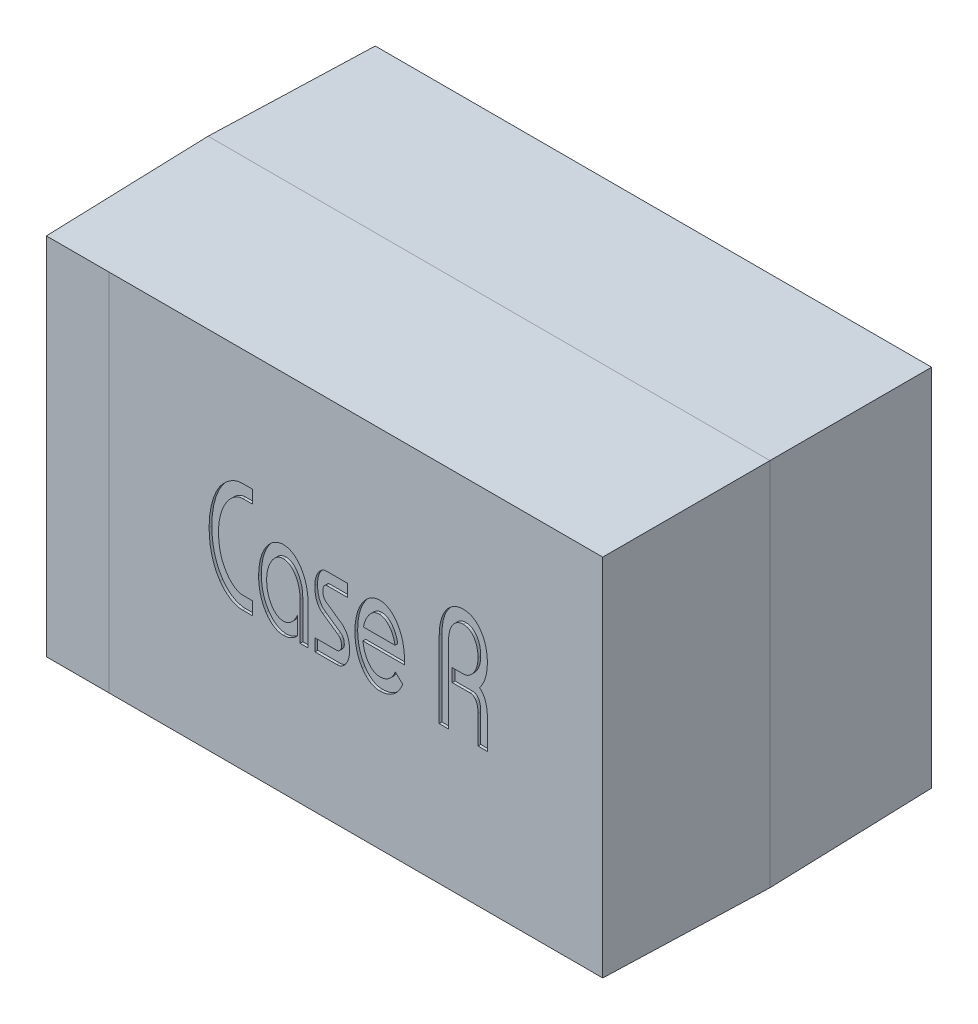
from build123d import *
from OCP.BRepFilletAPI import BRepFilletAPI_MakeChamfer

# Parameters (mm, degrees)
SKETCH1_W           = 2.05
SKETCH1_H           = 1.35
BOSS_EXTRUDE1_DEPTH = 1.2
CHAMFER3_SIZE       = 0.6
CHAMFER3_SIZE2      = 0.01
CHAMFER4_SIZE       = 0.01
CHAMFER4_SIZE_2     = 0.6
SKETCH3_W           = 0.228351356
SKETCH3_H           = 1.33
CUT_EXTRUDE1_DEPTH  = 0.01
SKETCH4_W           = 0.228351356
SKETCH4_H           = 1.33
BOSS_EXTRUDE4_DEPTH = 0.01
CUT_EXTRUDE2_DEPTH  = 0.01


with BuildPart() as part:
    # Sketch1 → Boss-Extrude1 (new body)
    with BuildSketch(Plane.XY):
        with Locations((1.025, 0.675)):
            Rectangle(SKETCH1_W, SKETCH1_H)
    extrude(amount=BOSS_EXTRUDE1_DEPTH)

    # Chamfer3: one chamfer whose edges measure the first distance from different faces: ONE call of the kernel's chamfer builder (chamfer() names one face for all edges)
    chamfer3_edges_1 = [part.edges().sort_by_distance(p)[0] for p in [
        (2.05, 0.675, 1.2),
    ]]
    chamfer3_side_1 = [part.faces().sort_by_distance(p)[0] for p in [
        (2.05, 0.675, 0.6),
    ]]
    chamfer3_edges_2 = [part.edges().sort_by_distance(p)[0] for p in [
        (1.025, 1.35, 1.2),
    ]]
    chamfer3_side_2 = [part.faces().sort_by_distance(p)[0] for p in [
        (1.025, 1.35, 0.6),
    ]]
    chamfer3_edges_3 = [part.edges().sort_by_distance(p)[0] for p in [
        (0, 0.675, 1.2),
    ]]
    chamfer3_side_3 = [part.faces().sort_by_distance(p)[0] for p in [
        (0, 0.675, 0.6),
    ]]
    chamfer3_edges_4 = [part.edges().sort_by_distance(p)[0] for p in [
        (1.025, 0, 1.2),
    ]]
    chamfer3_side_4 = [part.faces().sort_by_distance(p)[0] for p in [
        (1.025, 0, 0.6),
    ]]
    chamfer3 = BRepFilletAPI_MakeChamfer(part.part.solid().wrapped)
    for e in chamfer3_edges_1:
        chamfer3.Add(CHAMFER3_SIZE, CHAMFER3_SIZE2, e.wrapped, chamfer3_side_1[0].wrapped)  # the first distance lies on this face
    for e in chamfer3_edges_2:
        chamfer3.Add(CHAMFER3_SIZE, CHAMFER3_SIZE2, e.wrapped, chamfer3_side_2[0].wrapped)  # the first distance lies on this face
    for e in chamfer3_edges_3:
        chamfer3.Add(CHAMFER3_SIZE, CHAMFER3_SIZE2, e.wrapped, chamfer3_side_3[0].wrapped)  # the first distance lies on this face
    for e in chamfer3_edges_4:
        chamfer3.Add(CHAMFER3_SIZE, CHAMFER3_SIZE2, e.wrapped, chamfer3_side_4[0].wrapped)  # the first distance lies on this face
    add(Compound.cast(chamfer3.Shape()), mode=Mode.REPLACE)

    # Chamfer4
    chamfer4_edges_1 = [part.edges().sort_by_distance(p)[0] for p in [
        (1.025, 1.35, 0),
    ]]
    chamfer4_side_1 = [part.faces().sort_by_distance(p)[0] for p in [
        (1.025, 1.3498, 0),
    ]]
    chamfer4_edges_2 = [part.edges().sort_by_distance(p)[0] for p in [
        (0, 0.675, 0),
    ]]
    chamfer4_side_2 = [part.faces().sort_by_distance(p)[0] for p in [
        (0, 0.675, 0.0002),
    ]]
    chamfer4_edges_3 = [part.edges().sort_by_distance(p)[0] for p in [
        (1.025, 0, 0),
    ]]
    chamfer4_side_3 = [part.faces().sort_by_distance(p)[0] for p in [
        (1.025, 0, 0.0002),
    ]]
    chamfer4_edges_4 = [part.edges().sort_by_distance(p)[0] for p in [
        (2.05, 0.675, 0),
    ]]
    chamfer4_side_4 = [part.faces().sort_by_distance(p)[0] for p in [
        (2.0498, 0.675, 0),
    ]]
    chamfer4 = BRepFilletAPI_MakeChamfer(part.part.solid().wrapped)
    for e in chamfer4_edges_1:
        chamfer4.Add(CHAMFER4_SIZE - 0.0001, CHAMFER4_SIZE_2 - 0.0001, e.wrapped, chamfer4_side_1[0].wrapped)
    for e in chamfer4_edges_2:
        chamfer4.Add(CHAMFER4_SIZE_2 - 0.0001, CHAMFER4_SIZE - 0.0001, e.wrapped, chamfer4_side_2[0].wrapped)
    for e in chamfer4_edges_3:
        chamfer4.Add(CHAMFER4_SIZE_2 - 0.0001, CHAMFER4_SIZE - 0.0001, e.wrapped, chamfer4_side_3[0].wrapped)
    for e in chamfer4_edges_4:
        chamfer4.Add(CHAMFER4_SIZE - 0.0001, CHAMFER4_SIZE_2 - 0.0001, e.wrapped, chamfer4_side_4[0].wrapped)
    add(Compound.cast(chamfer4.Shape()), mode=Mode.REPLACE)  # a hair under: the kernel refuses the full size

    # Sketch3 → Cut-Extrude1 (cut)
    with BuildSketch(Plane.XY.offset(1.2)):
        with Locations((0.124175678, 0.675)):
            Rectangle(SKETCH3_W, SKETCH3_H)
    extrude(amount=-CUT_EXTRUDE1_DEPTH, mode=Mode.SUBTRACT)

    # Sketch5 → Cut-Extrude2 (cut)
    # profile 1 of 5: a face of its own
    with BuildSketch(Plane.XY.offset(1.2)):
        with BuildLine():
            Line((0.76121747, 0.515614059), (0.726594019, 0.515614059))
            add(Edge.make_bspline(
                [(0.726594019, 0.515614059), (0.722765896, 0.515771693), (0.71510314, 0.51608723), (0.703751237, 0.518790618), (0.692510981, 0.522892757), (0.681565006, 0.528842175), (0.670982858, 0.536243435), (0.66092916, 0.54506545), (0.651604582, 0.555367055), (0.646019402, 0.562972258), (0.643162179, 0.566862867)],
                knots=[0, 0, 0, 0, 0.901384534, 1.804301883, 2.737231396, 3.715875979, 4.731708272, 5.776406767, 6.862471662, 8, 8, 8, 8], degree=3))
            add(Edge.make_bspline(
                [(0.643162179, 0.566862867), (0.640068542, 0.571612157), (0.633758452, 0.581299279), (0.625910995, 0.597150464), (0.619190631, 0.614287288), (0.613572335, 0.632641349), (0.60916741, 0.652143405), (0.606105902, 0.672613602), (0.60412011, 0.693954205), (0.603914963, 0.708478889), (0.603810415, 0.71588098)],
                knots=[0, 0, 0, 0, 0.869024074, 1.772547916, 2.70757886, 3.690855553, 4.714628528, 5.77206063, 6.864594243, 8, 8, 8, 8], degree=3))
            add(Edge.make_bspline(
                [(0.603810415, 0.71588098), (0.603917977, 0.723231881), (0.604129384, 0.737679707), (0.606079771, 0.758927533), (0.609262739, 0.779308251), (0.61367456, 0.798781102), (0.619237217, 0.81719116), (0.626102411, 0.834341001), (0.633825574, 0.850364382), (0.640184432, 0.860104385), (0.643314705, 0.864899092)],
                knots=[0, 0, 0, 0, 1.127540334, 2.216123785, 3.270236229, 4.290144326, 5.277090742, 6.217127349, 7.122345999, 8, 8, 8, 8], degree=3))
            add(Edge.make_bspline(
                [(0.643314705, 0.864899092), (0.646152782, 0.8687824), (0.651699346, 0.876371699), (0.661291058, 0.886347154), (0.671278036, 0.895147868), (0.681869745, 0.902479445), (0.692835994, 0.908275415), (0.703947069, 0.912565587), (0.715243726, 0.915103733), (0.722819553, 0.915444354), (0.726594019, 0.915614059)],
                knots=[0, 0, 0, 0, 1.138826309, 2.225652577, 3.27197478, 4.289805443, 5.270858778, 6.205250352, 7.105810983, 8, 8, 8, 8], degree=3))
            Line((0.726594019, 0.915614059), (0.76121747, 0.915614059))
            Line((0.76121747, 0.915614059), (0.76121747, 0.868254669))
            Line((0.76121747, 0.868254669), (0.727127861, 0.868254669))
            add(Edge.make_bspline(
                [(0.727127861, 0.868254669), (0.724599618, 0.868110778), (0.719443526, 0.867817326), (0.711675587, 0.865720664), (0.703893131, 0.86220663), (0.696059757, 0.857469032), (0.688417717, 0.851548351), (0.681159359, 0.844505871), (0.674143918, 0.836575394), (0.67000027, 0.830650441), (0.667871426, 0.827606433)],
                knots=[0, 0, 0, 0, 0.813313755, 1.658670407, 2.570794204, 3.554385538, 4.598455433, 5.674757172, 6.805381345, 8, 8, 8, 8], degree=3))
            add(Edge.make_bspline(
                [(0.667871426, 0.827606433), (0.665456311, 0.823785469), (0.660603465, 0.81610776), (0.654661437, 0.803703915), (0.649404707, 0.790744584), (0.645270409, 0.777046128), (0.641928252, 0.762713042), (0.639745802, 0.747683009), (0.638195555, 0.732004748), (0.638050322, 0.721325124), (0.637976288, 0.71588098)],
                knots=[0, 0, 0, 0, 0.923892765, 1.856437245, 2.808522738, 3.782258558, 4.780023244, 5.816220665, 6.886776318, 8, 8, 8, 8], degree=3))
            add(Edge.make_bspline(
                [(0.637976288, 0.71588098), (0.638050492, 0.710436873), (0.638196057, 0.699757323), (0.639743905, 0.684078534), (0.641938588, 0.669025872), (0.645258556, 0.654662402), (0.649403646, 0.640940317), (0.654678522, 0.627964547), (0.66060101, 0.615502592), (0.665455648, 0.607773105), (0.667871426, 0.603926738)],
                knots=[0, 0, 0, 0, 1.111252342, 2.179912213, 3.214274696, 4.215331887, 5.187343378, 6.137742881, 7.073298734, 8, 8, 8, 8], degree=3))
            add(Edge.make_bspline(
                [(0.667871426, 0.603926738), (0.669996099, 0.600829041), (0.674120402, 0.594815955), (0.681164531, 0.586807376), (0.688391665, 0.57967618), (0.696066487, 0.573772118), (0.703870145, 0.56899161), (0.71170818, 0.56562753), (0.719428854, 0.563383735), (0.724596937, 0.563108324), (0.727127861, 0.562973449)],
                knots=[0, 0, 0, 0, 1.204278239, 2.337681846, 3.416432142, 4.457388018, 5.438045713, 6.344187209, 7.189112018, 8, 8, 8, 8], degree=3))
            Line((0.727127861, 0.562973449), (0.76121747, 0.562973449))
            Line((0.76121747, 0.562973449), (0.76121747, 0.515614059))
        make_face()
    # profile 2 of 5: a face of its own
    with BuildSketch(Plane.XY.offset(1.2)):
        with BuildLine():
            add(Edge.make_bspline(
                [(0.874696974, 0.752258482), (0.87262919, 0.752174568), (0.868523457, 0.752007951), (0.86252443, 0.750542125), (0.856702867, 0.748354232), (0.851212309, 0.745061627), (0.84586543, 0.74096709), (0.840799341, 0.735920864), (0.835965791, 0.729978641), (0.831465348, 0.723241226), (0.827306697, 0.715902216), (0.823622052, 0.70811585), (0.820585021, 0.699912328), (0.818084105, 0.691372064), (0.816056571, 0.682465803), (0.814741878, 0.673179214), (0.813867278, 0.663530253), (0.813747462, 0.656982437), (0.813686488, 0.653650284)],
                knots=[0, 0, 0, 0, 0.779160563, 1.547078783, 2.31846446, 3.118084419, 3.952729158, 4.854928777, 5.809322216, 6.838993993, 7.908686989, 8.990101826, 10.085929682, 11.206010702, 12.346406307, 13.529420003, 14.7427334, 16, 16, 16, 16], degree=3))
            add(Edge.make_bspline(
                [(0.813686488, 0.653650284), (0.813748092, 0.650318243), (0.813869148, 0.643770646), (0.81473253, 0.634145163), (0.816077776, 0.624864437), (0.818058157, 0.615972778), (0.82059892, 0.607442569), (0.823639117, 0.599243966), (0.827286241, 0.591414245), (0.831466435, 0.58405914), (0.835969825, 0.577326363), (0.840772794, 0.5713778), (0.84589187, 0.566411484), (0.851209257, 0.562312086), (0.856703639, 0.559023387), (0.862524228, 0.556834501), (0.868523508, 0.555368933), (0.872629207, 0.555202281), (0.874696974, 0.555118349)],
                knots=[0, 0, 0, 0, 1.257843931, 2.471714476, 3.645777637, 4.796063854, 5.907456426, 7.003787482, 8.094390452, 9.164574646, 10.194719243, 11.149550936, 12.045455767, 12.880483772, 13.680470912, 14.452210806, 15.22048165, 16, 16, 16, 16], degree=3))
            add(Edge.make_bspline(
                [(0.874696974, 0.555118349), (0.877255163, 0.555270408), (0.882390468, 0.555575651), (0.889894462, 0.557914772), (0.897123337, 0.561653187), (0.903942182, 0.566925254), (0.910449924, 0.573400202), (0.91625633, 0.581205277), (0.921715474, 0.589998819), (0.924553053, 0.59651264), (0.926022046, 0.599884793)],
                knots=[0, 0, 0, 0, 0.850292205, 1.706875191, 2.592345605, 3.546721236, 4.563769199, 5.638314415, 6.777374198, 8, 8, 8, 8], degree=3))
            Line((0.926022046, 0.599884793), (0.926022046, 0.533459626))
            add(Edge.make_bspline(
                [(0.926022046, 0.533459626), (0.924094103, 0.531621314), (0.920317621, 0.528020401), (0.914287696, 0.52330839), (0.908162841, 0.519279244), (0.901859353, 0.516065802), (0.895424665, 0.513529476), (0.888863357, 0.511683929), (0.882156606, 0.510587599), (0.877649751, 0.510430771), (0.875383342, 0.510351905)],
                knots=[0, 0, 0, 0, 1.117944603, 2.189846208, 3.208280688, 4.191656802, 5.154958918, 6.107975846, 7.048538433, 8, 8, 8, 8], degree=3))
            add(Edge.make_bspline(
                [(0.875383342, 0.510351905), (0.872347972, 0.510490555), (0.866264152, 0.510768454), (0.857291436, 0.512822259), (0.848564231, 0.516174866), (0.840087322, 0.520730074), (0.832075172, 0.526685385), (0.82449856, 0.533758649), (0.817351646, 0.541956154), (0.813167361, 0.54808146), (0.811017279, 0.55122893)],
                knots=[0, 0, 0, 0, 0.915144696, 1.834232688, 2.761378957, 3.728964671, 4.72744696, 5.763815247, 6.850943286, 8, 8, 8, 8], degree=3))
            add(Edge.make_bspline(
                [(0.811017279, 0.55122893), (0.808870331, 0.554727582), (0.804551641, 0.561765288), (0.799157327, 0.573067689), (0.794582219, 0.584980033), (0.790850862, 0.597527327), (0.787948707, 0.610679617), (0.785944238, 0.624444606), (0.784563814, 0.638827185), (0.784456345, 0.648638925), (0.784401454, 0.653650284)],
                knots=[0, 0, 0, 0, 0.91765608, 1.845909103, 2.796294767, 3.769555812, 4.771156598, 5.806112699, 6.879469122, 8, 8, 8, 8], degree=3))
            add(Edge.make_bspline(
                [(0.784401454, 0.653650284), (0.784457332, 0.658661583), (0.784567017, 0.668498532), (0.78593909, 0.682907037), (0.78795139, 0.696722768), (0.79086567, 0.709887214), (0.794477257, 0.722490335), (0.799118749, 0.73438245), (0.804389593, 0.745762646), (0.808664173, 0.752853022), (0.81078849, 0.75637669)],
                knots=[0, 0, 0, 0, 1.118528287, 2.195619465, 3.228725912, 4.234079734, 5.203991737, 6.15267889, 7.081946314, 8, 8, 8, 8], degree=3))
            add(Edge.make_bspline(
                [(0.81078849, 0.75637669), (0.812906248, 0.759505052), (0.817035704, 0.765605104), (0.824226116, 0.773662292), (0.831666932, 0.780804599), (0.839719657, 0.786619569), (0.848118803, 0.791179635), (0.856728509, 0.794674197), (0.865665933, 0.796578985), (0.871689343, 0.796876414), (0.874696974, 0.797024927)],
                knots=[0, 0, 0, 0, 1.146169583, 2.234937816, 3.272771314, 4.273554981, 5.240991483, 6.17007964, 7.086277752, 8, 8, 8, 8], degree=3))
            add(Edge.make_bspline(
                [(0.874696974, 0.797024927), (0.877731064, 0.796881227), (0.883757197, 0.79659582), (0.892705582, 0.79464224), (0.901319028, 0.791220484), (0.909689318, 0.786596412), (0.917727519, 0.780780624), (0.925247366, 0.773713981), (0.932348976, 0.765574399), (0.936481369, 0.759499332), (0.938605458, 0.75637669)],
                knots=[0, 0, 0, 0, 0.921289996, 1.82981263, 2.765958184, 3.726486938, 4.727128254, 5.77045587, 6.853993448, 8, 8, 8, 8], degree=3))
            add(Edge.make_bspline(
                [(0.938605458, 0.75637669), (0.94072911, 0.752852837), (0.945002354, 0.745762087), (0.950283389, 0.734384739), (0.954887576, 0.722474744), (0.95865375, 0.709912867), (0.961408482, 0.696709291), (0.963464699, 0.682909336), (0.964824316, 0.668497921), (0.964935733, 0.658661377), (0.964992494, 0.653650284)],
                knots=[0, 0, 0, 0, 0.918006956, 1.847227078, 2.795865941, 3.767338141, 4.771438435, 5.804492296, 6.881528648, 8, 8, 8, 8], degree=3))
            Line((0.964992494, 0.653650284), (0.964992494, 0.515461533))
            Line((0.964992494, 0.515461533), (0.93570746, 0.515461533))
            Line((0.93570746, 0.515461533), (0.93570746, 0.653650284))
            add(Edge.make_bspline(
                [(0.93570746, 0.653650284), (0.935646486, 0.656982437), (0.93552667, 0.663530253), (0.934652071, 0.673179214), (0.933337377, 0.682465803), (0.931309843, 0.691372064), (0.928808927, 0.699912328), (0.925771896, 0.70811585), (0.922087251, 0.715902216), (0.9179286, 0.723241226), (0.913428157, 0.729978641), (0.908594607, 0.735920864), (0.903528518, 0.74096709), (0.898181639, 0.745061627), (0.892691081, 0.748354232), (0.886869518, 0.750542125), (0.880870491, 0.752007951), (0.876764758, 0.752174568), (0.874696974, 0.752258482)],
                knots=[0, 0, 0, 0, 1.2572666, 2.470579997, 3.653593693, 4.793989298, 5.914070318, 7.009898174, 8.091313011, 9.161006007, 10.190677784, 11.145071223, 12.047270842, 12.881915581, 13.68153554, 14.452921217, 15.220839437, 16, 16, 16, 16], degree=3))
        make_face()
    # profile 3 of 5: a face of its own
    with BuildSketch(Plane.XY.offset(1.2)):
        with BuildLine():
            Line((1.073057317, 0.613002048), (1.019063037, 0.650828549))
            add(Edge.make_bspline(
                [(1.019063037, 0.650828549), (1.016687125, 0.652638915), (1.011930729, 0.656263131), (1.005860281, 0.663048553), (1.000737624, 0.670823065), (0.996528472, 0.679569934), (0.993356713, 0.689328817), (0.990981506, 0.700047978), (0.989645358, 0.711805281), (0.989481459, 0.719970469), (0.989396688, 0.724193659)],
                knots=[0, 0, 0, 0, 0.868859937, 1.739391943, 2.637231636, 3.574864269, 4.558733081, 5.620942188, 6.769506017, 8, 8, 8, 8], degree=3))
            add(Edge.make_bspline(
                [(0.989396688, 0.724193659), (0.98952574, 0.7286795), (0.989776259, 0.7373875), (0.992208136, 0.749909223), (0.996068916, 0.761456114), (1.000710031, 0.770135963), (1.004958135, 0.776400547), (1.008373481, 0.780427858), (1.011947319, 0.783854627), (1.015659014, 0.786739462), (1.019676265, 0.78882269), (1.023754194, 0.790521461), (1.028073151, 0.791430002), (1.03100727, 0.791549865), (1.032485344, 0.791610246)],
                knots=[0, 0, 0, 0, 1.833591361, 3.559401847, 5.197475214, 6.798067969, 7.568400634, 8.291575495, 8.953677215, 9.592323915, 10.206620691, 10.799589266, 11.395288333, 12, 12, 12, 12], degree=3))
            Line((1.032485344, 0.791610246), (1.108062084, 0.791610246))
            Line((1.108062084, 0.791610246), (1.108062084, 0.746843802))
            Line((1.108062084, 0.746843802), (1.033629291, 0.746843802))
            add(Edge.make_bspline(
                [(1.033629291, 0.746843802), (1.032625989, 0.746774017), (1.030594071, 0.746632686), (1.027698639, 0.745332716), (1.025121285, 0.743163708), (1.022910093, 0.740268366), (1.020987913, 0.736842496), (1.019626428, 0.732946959), (1.018880529, 0.728670435), (1.018749582, 0.725721761), (1.018681721, 0.724193659)],
                knots=[0, 0, 0, 0, 0.801860673, 1.623953486, 2.493496577, 3.480850765, 4.530676238, 5.633629486, 6.773667099, 8, 8, 8, 8], degree=3))
            add(Edge.make_bspline(
                [(1.018681721, 0.724193659), (1.018738421, 0.722286904), (1.018846006, 0.718668877), (1.019297996, 0.713543633), (1.02035118, 0.709069678), (1.021579643, 0.70506489), (1.023504777, 0.701543943), (1.025913462, 0.698284247), (1.028885486, 0.695254358), (1.031167761, 0.6934603), (1.032332818, 0.692544469)],
                knots=[0, 0, 0, 0, 1.26965316, 2.409138972, 3.41456123, 4.323899769, 5.186574054, 6.069572481, 7.014554535, 8, 8, 8, 8], degree=3))
            Line((1.032332818, 0.692544469), (1.084801836, 0.655709388))
            add(Edge.make_bspline(
                [(1.084801836, 0.655709388), (1.087330722, 0.653798686), (1.092360839, 0.649998178), (1.098792002, 0.6430039), (1.104263608, 0.635156694), (1.108679187, 0.626387729), (1.112137249, 0.61675849), (1.11451063, 0.606230321), (1.116101711, 0.594848966), (1.11623154, 0.586951303), (1.116298499, 0.58287812)],
                knots=[0, 0, 0, 0, 0.918812483, 1.827577132, 2.744965191, 3.68913645, 4.66982585, 5.708346027, 6.818090406, 8, 8, 8, 8], degree=3))
            add(Edge.make_bspline(
                [(1.116298499, 0.58287812), (1.11614226, 0.578341656), (1.115839634, 0.569554814), (1.113367587, 0.556902166), (1.109252578, 0.545300556), (1.104378978, 0.536621499), (1.099893903, 0.530434741), (1.096299602, 0.52643372), (1.092477237, 0.523066081), (1.088490626, 0.520291619), (1.084303978, 0.518087836), (1.079874285, 0.51659238), (1.075259199, 0.515631563), (1.072121468, 0.515518497), (1.070540635, 0.515461533)],
                knots=[0, 0, 0, 0, 1.812864952, 3.511403704, 5.131986983, 6.715678296, 7.472016075, 8.184526355, 8.861565098, 9.504471497, 10.122799072, 10.746451418, 11.368444669, 12, 12, 12, 12], degree=3))
            Line((1.070540635, 0.515461533), (0.98970174, 0.515461533))
            Line((0.98970174, 0.515461533), (0.98970174, 0.560227977))
            Line((0.98970174, 0.560227977), (1.069167899, 0.560227977))
            add(Edge.make_bspline(
                [(1.069167899, 0.560227977), (1.070376456, 0.560286538), (1.072791134, 0.560403541), (1.076157586, 0.561806931), (1.079293392, 0.563853984), (1.08192615, 0.56676724), (1.084269823, 0.570166748), (1.085814655, 0.574113501), (1.086879948, 0.578373154), (1.086968049, 0.581345735), (1.087013466, 0.58287812)],
                knots=[0, 0, 0, 0, 0.901279907, 1.800742513, 2.69452766, 3.692672087, 4.723962641, 5.775676774, 6.853346197, 8, 8, 8, 8], degree=3))
            add(Edge.make_bspline(
                [(1.087013466, 0.58287812), (1.086889348, 0.586105329), (1.086653819, 0.592229331), (1.083894812, 0.600674141), (1.079469183, 0.607869036), (1.07520753, 0.611280697), (1.073057317, 0.613002048)],
                knots=[0, 0, 0, 0, 1.116010939, 2.117759646, 3.05031746, 4, 4, 4, 4], degree=3))
        make_face()
    # profile 4 of 5: a face of its own
    with BuildSketch(Plane.XY.offset(1.2)):
        with BuildLine():
            add(Edge.make_bspline(
                [(1.227185058, 0.555118349), (1.230147804, 0.555240165), (1.236025639, 0.555481838), (1.244576817, 0.55773394), (1.252716899, 0.561258374), (1.260281452, 0.566314506), (1.267303076, 0.572545587), (1.273524412, 0.580078074), (1.27897414, 0.588714805), (1.281792976, 0.595090268), (1.283238442, 0.598359531)],
                knots=[0, 0, 0, 0, 0.94264986, 1.870136591, 2.798896372, 3.758420964, 4.756901232, 5.780763765, 6.862001397, 8, 8, 8, 8], degree=3))
            Line((1.283238442, 0.598359531), (1.310388108, 0.573116442))
            add(Edge.make_bspline(
                [(1.310388108, 0.573116442), (1.309297484, 0.570561638), (1.307166651, 0.565570127), (1.303558628, 0.558434534), (1.299687046, 0.551811847), (1.295543525, 0.545685496), (1.291199024, 0.539998842), (1.286553308, 0.534828883), (1.28166412, 0.530122571), (1.276442799, 0.526017), (1.271020247, 0.522334478), (1.265355395, 0.519128921), (1.259461584, 0.516344066), (1.25325385, 0.514127956), (1.246783506, 0.512487427), (1.240060065, 0.511248655), (1.233101472, 0.510463691), (1.228356488, 0.510389367), (1.225964848, 0.510351905)],
                knots=[0, 0, 0, 0, 1.184704104, 2.314644166, 3.408200006, 4.454834944, 5.467727095, 6.458316454, 7.417055784, 8.358655158, 9.287998919, 10.210676081, 11.132396935, 12.065339759, 13.017433063, 13.97666286, 14.980166188, 16, 16, 16, 16], degree=3))
            add(Edge.make_bspline(
                [(1.225964848, 0.510351905), (1.222953758, 0.510487064), (1.216942779, 0.510756881), (1.208061702, 0.512857037), (1.199398736, 0.516126946), (1.191055265, 0.520793238), (1.183011883, 0.52656884), (1.175568126, 0.533691703), (1.168461736, 0.541798406), (1.164331745, 0.547876133), (1.16220889, 0.551000141)],
                knots=[0, 0, 0, 0, 0.915244486, 1.827084374, 2.762144512, 3.724410354, 4.726861301, 5.766423803, 6.851920928, 8, 8, 8, 8], degree=3))
            add(Edge.make_bspline(
                [(1.16220889, 0.551000141), (1.160083842, 0.554523532), (1.155807789, 0.56161335), (1.150558131, 0.572976238), (1.145879511, 0.584828831), (1.142301072, 0.597391706), (1.13936029, 0.61052432), (1.137367133, 0.624292862), (1.135985922, 0.638649118), (1.135877231, 0.648435516), (1.135821855, 0.653421495)],
                knots=[0, 0, 0, 0, 0.920604417, 1.852453729, 2.798466561, 3.77107338, 4.773662011, 5.809638853, 6.88405389, 8, 8, 8, 8], degree=3))
            add(Edge.make_bspline(
                [(1.135821855, 0.653421495), (1.135876064, 0.658432996), (1.135982199, 0.668245014), (1.137374613, 0.682650645), (1.139349914, 0.6964475), (1.142312643, 0.709626219), (1.145880532, 0.722241041), (1.150541274, 0.734153081), (1.155809474, 0.745533999), (1.160084401, 0.75262428), (1.16220889, 0.756147901)],
                knots=[0, 0, 0, 0, 1.118546999, 2.190003065, 3.228740414, 4.228567886, 5.203944961, 6.152647985, 7.081930955, 8, 8, 8, 8], degree=3))
            add(Edge.make_bspline(
                [(1.16220889, 0.756147901), (1.164334226, 0.75929407), (1.168488911, 0.76544432), (1.175565519, 0.77366436), (1.183145023, 0.780710706), (1.191109745, 0.786634178), (1.199543521, 0.791174151), (1.208147795, 0.794675612), (1.217086609, 0.796578635), (1.223109836, 0.796876297), (1.226117374, 0.797024927)],
                knots=[0, 0, 0, 0, 1.149994207, 2.248051734, 3.278396411, 4.281565516, 5.246922372, 6.174013319, 7.08824193, 8, 8, 8, 8], degree=3))
            add(Edge.make_bspline(
                [(1.226117374, 0.797024927), (1.229151372, 0.796881109), (1.23517732, 0.796595467), (1.244127088, 0.794643648), (1.25273509, 0.791214963), (1.261139832, 0.786610762), (1.269090184, 0.780686431), (1.276748921, 0.773715984), (1.283736242, 0.765413788), (1.287894132, 0.759288369), (1.290025859, 0.756147901)],
                knots=[0, 0, 0, 0, 0.919300355, 1.82586092, 2.75998475, 3.718439121, 4.721455504, 5.757301447, 6.850180869, 8, 8, 8, 8], degree=3))
            add(Edge.make_bspline(
                [(1.290025859, 0.756147901), (1.292149685, 0.752624096), (1.29642328, 0.745533444), (1.301701638, 0.734155352), (1.306325124, 0.722225539), (1.310047562, 0.709651822), (1.312850491, 0.696433915), (1.314869976, 0.682652949), (1.31624993, 0.668244401), (1.3163578, 0.658432789), (1.316412894, 0.653421495)],
                knots=[0, 0, 0, 0, 0.918024109, 1.847261594, 2.795918183, 3.772848136, 4.77141762, 5.810104128, 6.88150775, 8, 8, 8, 8], degree=3))
            Line((1.316412894, 0.653421495), (1.316412894, 0.637711295))
            Line((1.316412894, 0.637711295), (1.165106888, 0.637711295))
            add(Edge.make_bspline(
                [(1.165106888, 0.637711295), (1.165427394, 0.634808517), (1.166057142, 0.629104982), (1.167590596, 0.620773809), (1.16960756, 0.612819484), (1.171906299, 0.605196378), (1.174797093, 0.597994869), (1.177935329, 0.59111824), (1.181660705, 0.584670278), (1.185703668, 0.578628256), (1.190119566, 0.573142889), (1.194754669, 0.56830081), (1.199648577, 0.564240294), (1.204741146, 0.560914746), (1.210025134, 0.558280023), (1.215569471, 0.556438734), (1.221321378, 0.555355384), (1.225223153, 0.555197658), (1.227185058, 0.555118349)],
                knots=[0, 0, 0, 0, 1.242139185, 2.440621989, 3.59996714, 4.732211145, 5.824711146, 6.898803124, 7.94509503, 8.988924805, 9.988803232, 10.937173895, 11.835836732, 12.687731271, 13.51962093, 14.34039983, 15.165513421, 16, 16, 16, 16], degree=3))
        make_face()
        with BuildLine():
            Line((1.167013466, 0.682477739), (1.282247022, 0.682477739))
            add(Edge.make_bspline(
                [(1.282247022, 0.682477739), (1.281225132, 0.687391513), (1.279244308, 0.696916342), (1.274359968, 0.710235867), (1.26834759, 0.722225321), (1.262178823, 0.731030694), (1.256772254, 0.737225454), (1.252539733, 0.741177638), (1.248304314, 0.744679619), (1.243825253, 0.747437017), (1.239223402, 0.749604909), (1.234479761, 0.751121843), (1.22961379, 0.752088881), (1.226325245, 0.752201661), (1.224668375, 0.752258482)],
                knots=[0, 0, 0, 0, 1.848807161, 3.583716608, 5.214723291, 6.783065686, 7.533604856, 8.243211442, 8.91672316, 9.556710209, 10.177455594, 10.788209023, 11.389462473, 12, 12, 12, 12], degree=3))
            add(Edge.make_bspline(
                [(1.224668375, 0.752258482), (1.223011689, 0.752201083), (1.219723508, 0.752087158), (1.214878645, 0.751133349), (1.210189223, 0.749602373), (1.20563899, 0.747428726), (1.201231709, 0.744639326), (1.196827225, 0.741397911), (1.192729781, 0.737335397), (1.187295212, 0.731200943), (1.181145346, 0.722372413), (1.175120387, 0.71035736), (1.170181894, 0.69698699), (1.168091876, 0.687416124), (1.167013466, 0.682477739)],
                knots=[0, 0, 0, 0, 0.610680656, 1.212075059, 1.81405405, 2.426460202, 3.066597283, 3.736142548, 4.43913099, 5.18984611, 6.758556174, 8.389945217, 10.13728007, 12, 12, 12, 12], degree=3))
        make_face(mode=Mode.SUBTRACT)
    # profile 5 of 5: a face of its own
    with BuildSketch(Plane.XY.offset(1.2)):
        with BuildLine():
            Line((1.555574, 0.668902906), (1.490902884, 0.668902906))
            Line((1.490902884, 0.668902906), (1.490902884, 0.716262296))
            Line((1.490902884, 0.716262296), (1.529644543, 0.716262296))
            add(Edge.make_bspline(
                [(1.529644543, 0.716262296), (1.531505545, 0.716339899), (1.535207101, 0.716494252), (1.540641067, 0.717602038), (1.545893691, 0.719343423), (1.550871675, 0.721911697), (1.555661207, 0.725160394), (1.560226789, 0.72914398), (1.564577241, 0.733854407), (1.568742241, 0.739136584), (1.572518542, 0.744958271), (1.575793604, 0.751177354), (1.578640153, 0.757663117), (1.580916527, 0.764456349), (1.582673738, 0.771550138), (1.583964138, 0.778911983), (1.584752642, 0.786610446), (1.584823051, 0.791837128), (1.584859033, 0.794508244)],
                knots=[0, 0, 0, 0, 0.844684714, 1.680089075, 2.508766528, 3.350289985, 4.21477895, 5.13134455, 6.095111081, 7.122784412, 8.182632153, 9.241284706, 10.311455577, 11.395667958, 12.490399794, 13.627232452, 14.787387778, 16, 16, 16, 16], degree=3))
            add(Edge.make_bspline(
                [(1.584859033, 0.794508244), (1.584815064, 0.797381867), (1.584729329, 0.802985179), (1.584062524, 0.811195649), (1.582804662, 0.818950749), (1.581255704, 0.826340113), (1.579089264, 0.833288895), (1.576520442, 0.839855926), (1.573462824, 0.845985225), (1.569962452, 0.851626584), (1.566079962, 0.856733001), (1.561924408, 0.861243712), (1.55745804, 0.865024823), (1.552740175, 0.86810718), (1.547777912, 0.870615791), (1.542454826, 0.87222676), (1.536915108, 0.873397076), (1.533108312, 0.87347642), (1.531169805, 0.873516824)],
                knots=[0, 0, 0, 0, 1.297204174, 2.529433525, 3.714262041, 4.841973546, 5.934572549, 6.995805537, 8.022217935, 9.022114313, 9.988387689, 10.914010236, 11.785327966, 12.622420609, 13.45383049, 14.284923524, 15.126644274, 16, 16, 16, 16], degree=3))
            add(Edge.make_bspline(
                [(1.531169805, 0.873516824), (1.529231299, 0.87347642), (1.525424502, 0.873397076), (1.519884785, 0.87222676), (1.514561699, 0.870615791), (1.509599436, 0.86810718), (1.504881571, 0.865024823), (1.500415203, 0.861243712), (1.496259649, 0.856733001), (1.492377159, 0.851626584), (1.488876787, 0.845985225), (1.485819169, 0.839855926), (1.483250346, 0.833288895), (1.481083907, 0.826340113), (1.479534949, 0.818950749), (1.478277087, 0.811195649), (1.477610282, 0.802985179), (1.477524546, 0.797381867), (1.477480577, 0.794508244)],
                knots=[0, 0, 0, 0, 0.873355726, 1.715076476, 2.54616951, 3.377579391, 4.214672034, 5.085989764, 6.011612311, 6.977885687, 7.977782065, 9.004194463, 10.065427451, 11.158026454, 12.285737959, 13.470566475, 14.702795826, 16, 16, 16, 16], degree=3))
            Line((1.477480577, 0.794508244), (1.477480577, 0.515461533))
            Line((1.477480577, 0.515461533), (1.443314705, 0.515461533))
            Line((1.443314705, 0.515461533), (1.443314705, 0.794508244))
            add(Edge.make_bspline(
                [(1.443314705, 0.794508244), (1.443383874, 0.799061285), (1.443519347, 0.807978878), (1.444698773, 0.821044117), (1.446540942, 0.833495507), (1.449327267, 0.845254275), (1.452729001, 0.856362641), (1.456923542, 0.866821394), (1.462008948, 0.876573912), (1.467636772, 0.885736824), (1.474046374, 0.893905729), (1.480812942, 0.901171145), (1.488132781, 0.907241128), (1.495862528, 0.912269919), (1.504095885, 0.916089485), (1.512724862, 0.918853948), (1.521795104, 0.920604329), (1.528009586, 0.920784561), (1.531169805, 0.920876214)],
                knots=[0, 0, 0, 0, 1.274663131, 2.496557385, 3.670399202, 4.7961629, 5.87687122, 6.921120667, 7.946247039, 8.953548102, 9.927474085, 10.848922792, 11.728422418, 12.583382807, 13.424089621, 14.261505275, 15.115932111, 16, 16, 16, 16], degree=3))
            add(Edge.make_bspline(
                [(1.531169805, 0.920876214), (1.534329978, 0.920784484), (1.54054437, 0.9206041), (1.549615269, 0.918854821), (1.55824181, 0.916086273), (1.566464873, 0.912291036), (1.574144067, 0.907219482), (1.581446134, 0.901145683), (1.588309789, 0.893961332), (1.594594345, 0.885679376), (1.600372685, 0.87662713), (1.605295464, 0.866776204), (1.609640666, 0.856386437), (1.613003018, 0.845250131), (1.615801327, 0.833496688), (1.617640084, 0.821043783), (1.618820465, 0.807978968), (1.618955805, 0.799061315), (1.619024905, 0.794508244)],
                knots=[0, 0, 0, 0, 0.884188633, 1.738732163, 2.57626219, 3.417083825, 4.266183116, 5.145802862, 6.07228652, 7.041991025, 8.053220863, 9.075244171, 10.122326133, 11.203182053, 12.329099505, 13.503101642, 14.725162779, 16, 16, 16, 16], degree=3))
            add(Edge.make_bspline(
                [(1.619024905, 0.794508244), (1.618931254, 0.789980752), (1.618747765, 0.78111015), (1.617479504, 0.76809454), (1.615155707, 0.755716038), (1.61205465, 0.743890545), (1.607989938, 0.732676146), (1.603126948, 0.721990561), (1.59722351, 0.711953518), (1.59264165, 0.705725979), (1.590349977, 0.702611199)],
                knots=[0, 0, 0, 0, 1.107625724, 2.170143127, 3.194764397, 4.185864802, 5.157675082, 6.109357557, 7.054371922, 8, 8, 8, 8], degree=3))
            add(Edge.make_bspline(
                [(1.590349977, 0.702611199), (1.59265236, 0.70067046), (1.59732046, 0.696735596), (1.603232936, 0.689437501), (1.608087083, 0.68092168), (1.612150047, 0.671325901), (1.615224992, 0.660536054), (1.617523033, 0.64859944), (1.618758516, 0.635449388), (1.618933795, 0.626299624), (1.619024905, 0.621543516)],
                knots=[0, 0, 0, 0, 0.810349982, 1.642991606, 2.515049416, 3.445409744, 4.445035431, 5.533593625, 6.717945661, 8, 8, 8, 8], degree=3))
            Line((1.619024905, 0.621543516), (1.619024905, 0.515461533))
            Line((1.619024905, 0.515461533), (1.584859033, 0.515461533))
            Line((1.584859033, 0.515461533), (1.584859033, 0.617654097))
            add(Edge.make_bspline(
                [(1.584859033, 0.617654097), (1.58478128, 0.621572918), (1.584635316, 0.628929639), (1.583313275, 0.6392555), (1.580987072, 0.648121169), (1.577759442, 0.655582896), (1.573563478, 0.661517311), (1.568426509, 0.665914296), (1.562239309, 0.668435899), (1.557832923, 0.668744634), (1.555574, 0.668902906)],
                knots=[0, 0, 0, 0, 1.425477421, 2.676019604, 3.777660952, 4.75060073, 5.618314043, 6.39992343, 7.179724739, 8, 8, 8, 8], degree=3))
        make_face()
    extrude(amount=-CUT_EXTRUDE2_DEPTH, mode=Mode.SUBTRACT)


with BuildPart() as body_2:
    # Sketch4 → Boss-Extrude4 (new body)
    with BuildSketch(Plane.XY.offset(1.19)):
        with Locations((0.124175678, 0.675)):
            Rectangle(SKETCH4_W, SKETCH4_H)
    extrude(amount=BOSS_EXTRUDE4_DEPTH)


solid = Compound([part.part, body_2.part])
